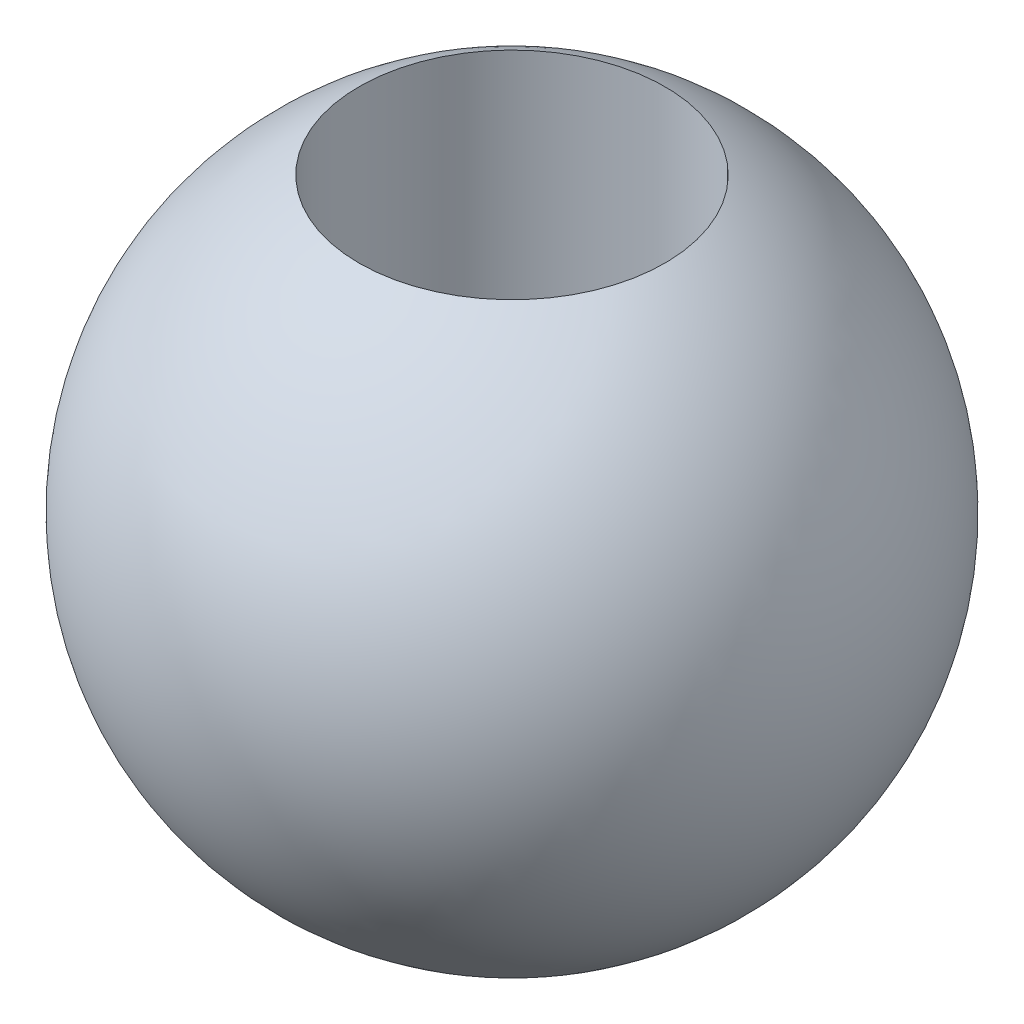
from build123d import *


with BuildPart() as part:
    # Sketch2 → Revolve1 (revolve)
    with BuildSketch(Plane(origin=(0, 0, 0), x_dir=(0, 0, -1), z_dir=(1, 0, 0))):
        with BuildLine():
            Line((-1.4732, -2.812526757), (-1.4732, 2.812526757))
            ThreePointArc((-1.4732, 2.812526757), (-3.175, 0), (-1.4732, -2.812526757))
        make_face()
    revolve(axis=Axis((0, -1000, 0), (0, 1, 0)))


solid = part.part
